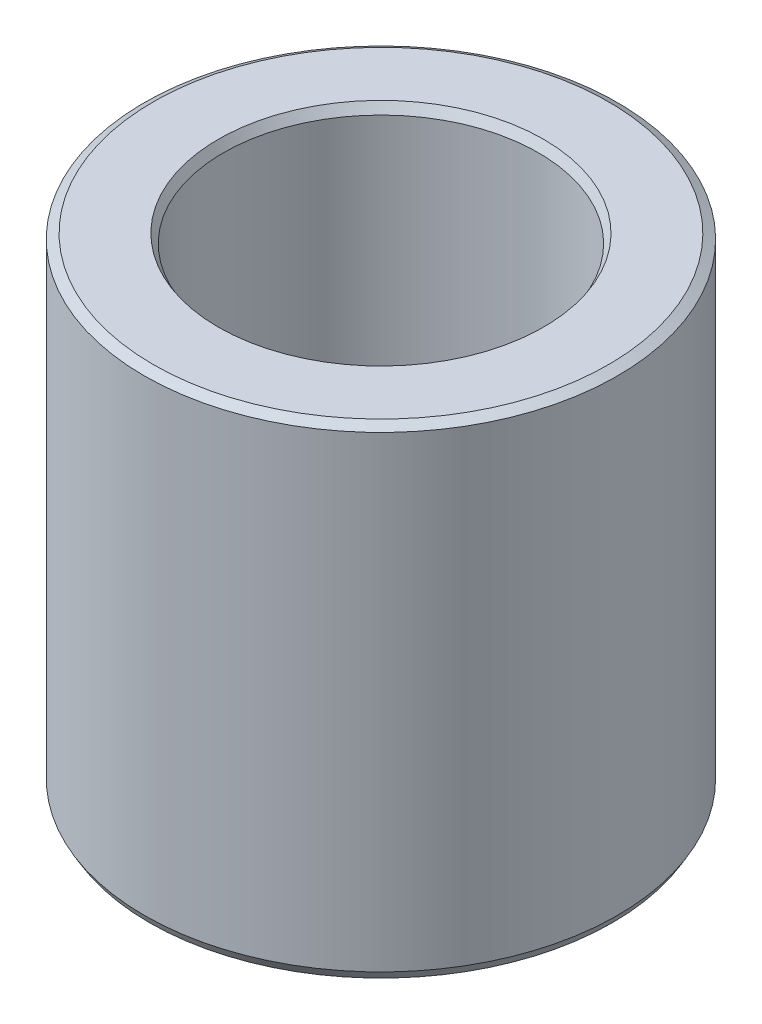
from build123d import *
from OCP.BRepFilletAPI import BRepFilletAPI_MakeChamfer

# Parameters (mm, degrees)
SKETCH1_R           = 32.5
BOSS_EXTRUDE1_DEPTH = 66.118120435
SKETCH2_R           = 21.628242845
CUT_EXTRUDE1_DEPTH  = 81.523945816
CHAMFER1_SIZE       = 0.715533237
CHAMFER1_SIZE2      = 1.239339922


with BuildPart() as part:
    # Sketch1 → Boss-Extrude1 (new body)
    with BuildSketch(Plane(origin=(0, 0, 0), x_dir=(1, 0, 0), z_dir=(0, 1, 0))):
        Circle(SKETCH1_R)
    extrude(amount=BOSS_EXTRUDE1_DEPTH)

    # Sketch2 → Cut-Extrude1 (cut, through all)
    with BuildSketch(Plane(origin=(0, 0, 0), x_dir=(1, 0, 0), z_dir=(0, 1, 0))):
        Circle(SKETCH2_R)
    extrude(amount=CUT_EXTRUDE1_DEPTH, mode=Mode.SUBTRACT)

    # Chamfer1: one chamfer whose edges measure the first distance from different faces: ONE call of the kernel's chamfer builder (chamfer() names one face for all edges)
    chamfer1_edges_1 = [part.edges().sort_by_distance(p)[0] for p in [
        (-21.628242845, 66.118120435, 0),
    ]]
    chamfer1_side_1 = [part.faces().sort_by_distance(p)[0] for p in [
        (-31.580761184, 66.118120435, 0),
    ]]
    chamfer1_edges_2 = [part.edges().sort_by_distance(p)[0] for p in [
        (-21.628242845, 0, 0),
    ]]
    chamfer1_side_2 = [part.faces().sort_by_distance(p)[0] for p in [
        (-21.628242845, 33.059060217, 0),
    ]]
    chamfer1_edges_3 = [part.edges().sort_by_distance(p)[0] for p in [
        (-32.5, 0, 0),
    ]]
    chamfer1_side_3 = [part.faces().sort_by_distance(p)[0] for p in [
        (-31.580761184, 0, 0),
    ]]
    chamfer1_edges_4 = [part.edges().sort_by_distance(p)[0] for p in [
        (-32.5, 66.118120435, 0),
    ]]
    chamfer1_side_4 = [part.faces().sort_by_distance(p)[0] for p in [
        (-32.5, 33.059060217, 0),
    ]]
    chamfer1 = BRepFilletAPI_MakeChamfer(part.part.solid().wrapped)
    for e in chamfer1_edges_1:
        chamfer1.Add(CHAMFER1_SIZE, CHAMFER1_SIZE2, e.wrapped, chamfer1_side_1[0].wrapped)  # the first distance lies on this face
    for e in chamfer1_edges_2:
        chamfer1.Add(CHAMFER1_SIZE, CHAMFER1_SIZE2, e.wrapped, chamfer1_side_2[0].wrapped)  # the first distance lies on this face
    for e in chamfer1_edges_3:
        chamfer1.Add(CHAMFER1_SIZE, CHAMFER1_SIZE2, e.wrapped, chamfer1_side_3[0].wrapped)  # the first distance lies on this face
    for e in chamfer1_edges_4:
        chamfer1.Add(CHAMFER1_SIZE, CHAMFER1_SIZE2, e.wrapped, chamfer1_side_4[0].wrapped)  # the first distance lies on this face
    add(Compound.cast(chamfer1.Shape()), mode=Mode.REPLACE)


solid = part.part
